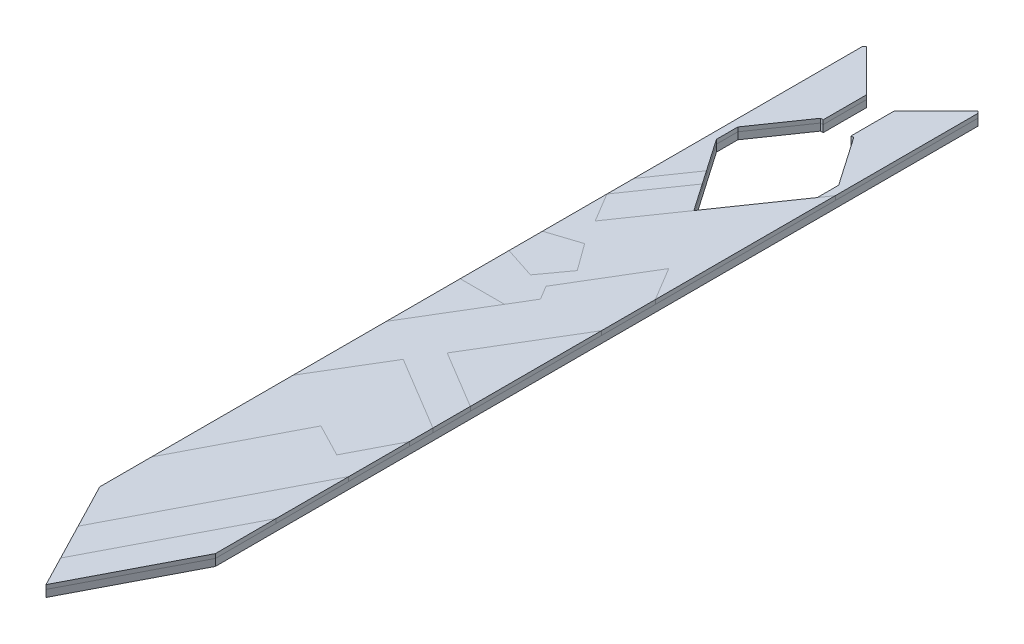
from build123d import *

# Parameters (mm, degrees)
EXTRUDE_1_DEPTH          = 5
CUT_EXTRUDE_1_REACH      = 623.694
CUT_EXTRUDE_8_DEPTH      = 622.694149643
CUT_EXTRUDE_8_DEPTH_BACK = 622.694149643
SKETCH_4_W               = 20
SKETCH_4_H               = 31
EXTRUDE_2_DEPTH          = 5
EXTRUDE_8_DEPTH          = 3
EXTRUDE_8_2_DEPTH        = 3
EXTRUDE_8_3_DEPTH        = 3
EXTRUDE_8_4_DEPTH        = 3
EXTRUDE_8_5_DEPTH        = 3
EXTRUDE_9_DEPTH          = 3
EXTRUDE_9_2_DEPTH        = 3
EXTRUDE_12_DEPTH         = 3
EXTRUDE_12_2_DEPTH       = 3
EXTRUDE_12_3_DEPTH       = 3
EXTRUDE_12_4_DEPTH       = 3
EXTRUDE_12_5_DEPTH       = 3
EXTRUDE_14_DEPTH         = 3
EXTRUDE_14_2_DEPTH       = 3


# Read off the part's stored shape, not the designer's step: 凸台-拉伸9
with BuildPart() as part:
    # 草图1 → 凸台-拉伸1 (new body)
    with BuildSketch(Plane(origin=(0, 0, 0), x_dir=(1, 0, 0), z_dir=(0, 1, 0))):
        Polygon((40, 0), (0, -40), (-40, 0), (-41.46, -1.46), (-41.46, -540.3), (0, -620.29), (41.46, -540.3), (41.46, -1.46), align=None)
    extrude(amount=EXTRUDE_1_DEPTH)

    # 草图2 → 切除-拉伸1 (cut, up to next)
    with BuildSketch(Plane(origin=(0, 5, 0), x_dir=(1, 0, 0), z_dir=(0, 1, 0)), mode=Mode.PRIVATE) as cut_extrude_1_sk1:
        Polygon((11.93, -61), (-11.93, -61), (-36.16, -96.06), (-36.16, -111.41), (0, -163.74), (36.16, -111.41), (36.16, -96.06), align=None)
    cut_extrude_1_tool1 = extrude(cut_extrude_1_sk1.sketch, amount=-CUT_EXTRUDE_1_REACH, mode=Mode.PRIVATE) & part.part
    add(cut_extrude_1_tool1.solids().sort_by_distance((0, 5, 105.867422))[0], mode=Mode.SUBTRACT)

    # 草图4 → 切除-拉伸8 (cut, two sides: drawn at the far end of the back side and taken through both)
    with BuildSketch(Plane.XZ.offset(-CUT_EXTRUDE_8_DEPTH_BACK)):
        with Locations((0, 45.5)):
            Rectangle(SKETCH_4_W, SKETCH_4_H)
    extrude(amount=CUT_EXTRUDE_8_DEPTH + CUT_EXTRUDE_8_DEPTH_BACK, mode=Mode.SUBTRACT)

    # 草图5 → 凸台-拉伸2 (add)
    with BuildSketch(Plane.XZ):
        Polygon((-41.46, 540.3), (-41.46, 548.3), (0, 628.29), (41.46, 548.3), (41.46, 540.3), (0, 620.29), align=None)
    extrude(amount=-EXTRUDE_2_DEPTH)


with BuildPart() as body_2:
    # 草图9 → 凸台-拉伸8 (new body)
    with BuildSketch(Plane(origin=(0, 5, 0), x_dir=(1, 0, 0), z_dir=(0, 1, 0))):
        Polygon((-41.46, -342.84), (-9.66, -289.84), (-41.46, -289.84), align=None)
    extrude(amount=EXTRUDE_8_DEPTH)


with BuildPart() as body_3:
    # 草图9 → Extrude 8 2 (new body)
    with BuildSketch(Plane(origin=(0, 5, 0), x_dir=(1, 0, 0), z_dir=(0, 1, 0))):
        Polygon((-28.903164688, -205.568058853), (0, -163.74), (-13.509055991, -144.189975111), (-41.46, -184.64), align=None)
    extrude(amount=EXTRUDE_8_2_DEPTH)


with BuildPart() as body_4:
    # 草图9 → Extrude 8 3 (new body)
    with BuildSketch(Plane(origin=(0, 5, 0), x_dir=(1, 0, 0), z_dir=(0, 1, 0))):
        Polygon((-41.46, -230.84), (-41.46, -254.84), (-18.634643609, -262.256407865), (-4.527797554, -242.84), (-18.634643609, -223.423592135), align=None)
    extrude(amount=EXTRUDE_8_3_DEPTH)


with BuildPart() as body_5:
    # 草图9 → Extrude 8 4 (new body)
    with BuildSketch(Plane(origin=(0, 5, 0), x_dir=(1, 0, 0), z_dir=(0, 1, 0))):
        Polygon((36.16, -111.41), (41.46, -103.739950221), (41.46, -1.46), (40, 0), (10, -30), (10, -61), (11.93, -61), (36.16, -96.06), align=None)
    extrude(amount=EXTRUDE_8_4_DEPTH)


with BuildPart() as body_6:
    # 草图9 → Extrude 8 5 (new body)
    with BuildSketch(Plane(origin=(0, 5, 0), x_dir=(1, 0, 0), z_dir=(0, 1, 0))):
        Polygon((-41.46, -165.290228805), (-20.194396392, -134.515089513), (-36.16, -111.41), (-36.16, -96.06), (-11.93, -61), (-10, -61), (-10, -30), (-40, 0), (-41.46, -1.46), align=None)
    extrude(amount=EXTRUDE_8_5_DEPTH)


with BuildPart() as body_7:
    # 凸台-拉伸9 outline → 凸台-拉伸9 (new body)
    with BuildSketch(Plane(origin=(0, 5, 0), x_dir=(1, 0, 0), z_dir=(0, 1, 0))):
        Polygon((41.46, -548.3), (41.46, -504.838236483), (-11.263437401, -606.559118242), (0, -628.29), align=None)
    extrude(amount=EXTRUDE_9_DEPTH)


with BuildPart() as body_8:
    # Extrude 9 2 outline → Extrude 9 2 (new body)
    with BuildSketch(Plane(origin=(0, 5, 0), x_dir=(1, 0, 0), z_dir=(0, 1, 0))):
        Polygon((-41.46, -289.84), (-41.46, -342.84), (-9.66, -289.84), align=None)
    extrude(amount=EXTRUDE_9_2_DEPTH)


with BuildPart() as body_9:
    # 草图9<12> → 凸台-拉伸12 (new body)
    with BuildSketch(Plane(origin=(0, 5, 0), x_dir=(1, 0, 0), z_dir=(0, 1, 0))):
        Polygon((-9.66, -289.84), (0, -273.74), (-6, -263.74), (27, -208.74), (41.46, -232.84), (41.46, -103.739950221), (-28.903164688, -205.568058853), (-41.46, -184.64), (-41.46, -230.84), (-18.634643609, -223.423592135), (-4.527797554, -242.84), (-18.634643609, -262.256407865), (-41.46, -254.84), (-41.46, -289.84), align=None)
    extrude(amount=EXTRUDE_12_DEPTH)


with BuildPart() as body_10:
    # 草图9<12> → Extrude 12 2 (new body)
    with BuildSketch(Plane(origin=(0, 5, 0), x_dir=(1, 0, 0), z_dir=(0, 1, 0))):
        Polygon((-11.833402375, -360.327795222), (-41.46, -409.70545793), (-41.46, -511.184789097), (0, -431.194789097), (23.703431301, -443.480628098), (41.46, -409.222356746), (41.46, -392.303836646), align=None)
    extrude(amount=EXTRUDE_12_2_DEPTH)


with BuildPart() as body_11:
    # 草图9<12> → Extrude 12 3 (new body)
    with BuildSketch(Plane(origin=(0, 5, 0), x_dir=(1, 0, 0), z_dir=(0, 1, 0))):
        Polygon((41.46, -365.48145793), (41.46, -271.50545793), (0, -340.60545793), align=None)
    extrude(amount=EXTRUDE_12_3_DEPTH)


with BuildPart() as body_12:
    # 草图9<12> → Extrude 12 4 (new body)
    with BuildSketch(Plane(origin=(0, 5, 0), x_dir=(1, 0, 0), z_dir=(0, 1, 0))):
        Polygon((-41.46, -184.64), (-13.509055991, -144.189975111), (-20.194396392, -134.515089513), (-41.46, -165.290228805), align=None)
    extrude(amount=EXTRUDE_12_4_DEPTH)


with BuildPart() as body_13:
    # 草图9<12> → Extrude 12 5 (new body)
    with BuildSketch(Plane(origin=(0, 5, 0), x_dir=(1, 0, 0), z_dir=(0, 1, 0))):
        Polygon((41.46, -504.838236483), (41.46, -452.684120263), (-24.779562282, -580.482060131), (-11.263437401, -606.559118242), align=None)
    extrude(amount=EXTRUDE_12_5_DEPTH)


with BuildPart() as body_14:
    # 草图9<17> → 凸台-拉伸14 (new body)
    with BuildSketch(Plane(origin=(0, 5, 0), x_dir=(1, 0, 0), z_dir=(0, 1, 0))):
        Polygon((27, -208.74), (-6, -263.74), (0, -273.74), (-41.46, -342.84), (-41.46, -409.70545793), (-11.833402375, -360.327795222), (41.46, -392.303836646), (41.46, -365.48145793), (0, -340.60545793), (41.46, -271.50545793), (41.46, -232.84), align=None)
    extrude(amount=EXTRUDE_14_DEPTH)


with BuildPart() as body_15:
    # 草图9<17> → Extrude 14 2 (new body)
    with BuildSketch(Plane(origin=(0, 5, 0), x_dir=(1, 0, 0), z_dir=(0, 1, 0))):
        Polygon((23.703431301, -443.480628098), (0, -431.194789097), (-41.46, -511.184789097), (-41.46, -548.3), (-24.779562282, -580.482060131), (41.46, -452.684120263), (41.46, -409.222356746), align=None)
    extrude(amount=EXTRUDE_14_2_DEPTH)


solid = Compound([part.part, body_2.part, body_3.part, body_4.part, body_5.part, body_6.part, body_7.part, body_8.part, body_9.part, body_10.part, body_11.part, body_12.part, body_13.part, body_14.part, body_15.part])
